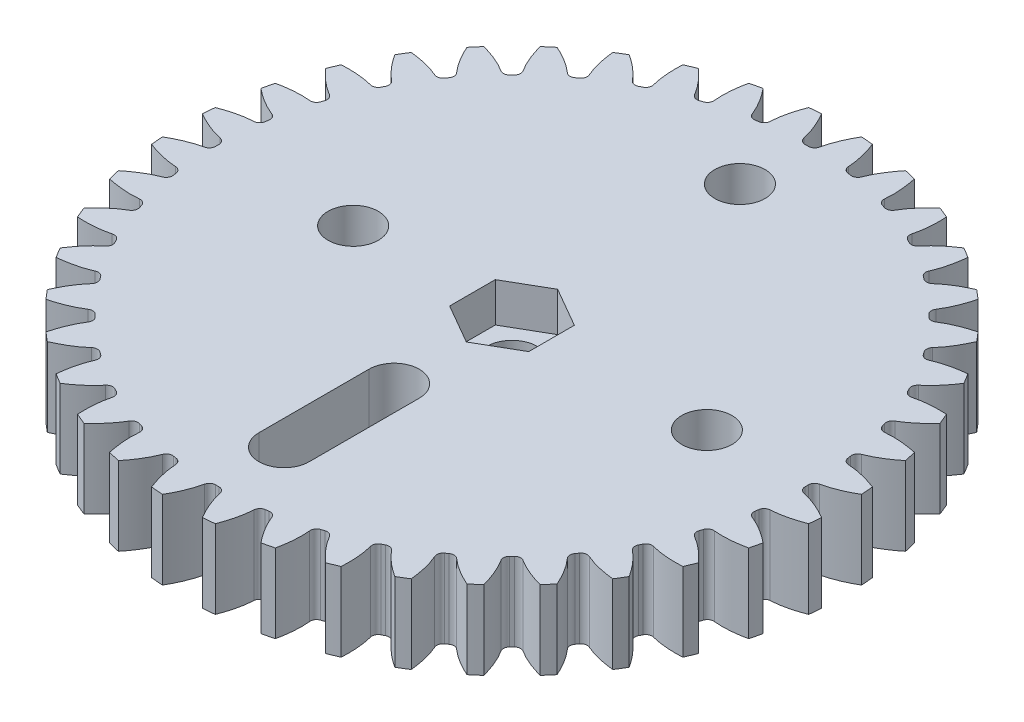
from build123d import *

# Parameters (mm, degrees)
SKETCH2_R                = 53.34
BOSS_EXTRUDE1_DEPTH      = 12.7
CUT_EXTRUDE1_DEPTH       = 12.7
FILLET2_R                = 1.016
CIRPATTERN1_COUNT        = 40
FILLET2_OF_CIRPATTERN1_R = 1.016
SKETCH4_R                = 4.09575
CUT_EXTRUDE2_DEPTH       = 77.359986682
CUT_EXTRUDE3_DEPTH       = 6.35
CUT_EXTRUDE4_DEPTH       = 77.359986682
CUT_EXTRUDE4_DEPTH_BACK  = 77.359986682
SKETCH6_R                = 4.064


with BuildPart() as part:
    # Sketch2 → Boss-Extrude1 (new body)
    with BuildSketch(Plane(origin=(0, 0, 0), x_dir=(1, 0, 0), z_dir=(0, 1, 0))):
        Circle(SKETCH2_R)
    extrude(amount=BOSS_EXTRUDE1_DEPTH)

    # Sketch3 → Cut-Extrude1 (cut)
    with BuildSketch(Plane(origin=(0, 0, 0), x_dir=(-1, 0, 0), z_dir=(0, -1, 0))):
        with BuildLine():
            Line((47.610863724, -1.16029328), (47.722215798, -1.163006969))
            add(Edge.make_bspline(
                [(47.722215798, -1.163006969), (47.730982789, -1.163313167), (47.755564012, -1.16445845), (47.802003051, -1.167754997), (47.87772523, -1.174741096), (47.974119041, -1.186004909), (48.098593622, -1.203276497), (48.245061479, -1.227112329), (48.405834144, -1.256963367), (48.580520514, -1.293386204), (48.754577285, -1.333212779), (48.927987969, -1.376189951), (49.100522746, -1.421931459), (49.30925176, -1.48080125), (49.559155717, -1.556203831), (49.850651678, -1.651349023), (50.180503564, -1.767531099), (50.515821541, -1.894787282), (50.845048793, -2.027276114), (51.176798745, -2.169495413), (51.497150175, -2.313020498), (51.828924093, -2.470658837), (52.134675109, -2.620519189), (52.476090794, -2.797888155), (52.751288045, -2.94379105), (53.034579939, -3.102405155), (53.172312998, -3.180768911), (53.242640535, -3.221308569)],
                knots=[0, 0, 0, 0, 0, 0.005376749, 0.015083688, 0.02853182, 0.04661014, 0.064854849, 0.092110526, 0.119476176, 0.146842496, 0.174208854, 0.201574956, 0.228941013, 0.256307345, 0.307035032, 0.361767352, 0.416499661, 0.471231937, 0.525964282, 0.580696616, 0.635428982, 0.690161387, 0.744893688, 0.799626082, 0.854358407, 0.909090914, 0.909090914, 0.909090914, 0.909090914, 0.909090914], degree=4))
            ThreePointArc((53.242640535, -3.221308569), (53.34, 0), (53.242640535, 3.221308569))
            add(Edge.make_bspline(
                [(53.242640535, 3.221308569), (53.172312998, 3.180768911), (53.034579939, 3.102405155), (52.751288045, 2.94379105), (52.476090794, 2.797888155), (52.134675109, 2.620519189), (51.828924093, 2.470658837), (51.497150175, 2.313020498), (51.176798745, 2.169495413), (50.845048793, 2.027276114), (50.515821541, 1.894787282), (50.180503564, 1.767531099), (49.850651678, 1.651349023), (49.559155717, 1.556203831), (49.30925176, 1.48080125), (49.100522746, 1.421931459), (48.927987969, 1.376189951), (48.754577285, 1.333212779), (48.580520514, 1.293386204), (48.405834144, 1.256963367), (48.245061479, 1.227112329), (48.098593622, 1.203276497), (47.974119041, 1.186004909), (47.87772523, 1.174741096), (47.80200305, 1.167754997), (47.755564012, 1.16445845), (47.730982789, 1.163313167), (47.722215798, 1.163006969)],
                knots=[0.484570751, 0.484570751, 0.484570751, 0.484570751, 0.484570751, 0.539303258, 0.594035583, 0.648767977, 0.703500278, 0.758232683, 0.81296505, 0.867697383, 0.922429728, 0.977162004, 1.031894313, 1.086626633, 1.13735432, 1.164720652, 1.19208671, 1.219452811, 1.246819169, 1.274185489, 1.30155114, 1.328806816, 1.347051526, 1.365129845, 1.378577977, 1.388284917, 1.393661665, 1.393661665, 1.393661665, 1.393661665, 1.393661665], degree=4))
            Line((47.722215798, 1.163006969), (47.610863724, 1.16029328))
            ThreePointArc((47.610863724, 1.16029328), (47.625, 0), (47.610863724, -1.16029328))
        make_face()
    cut_extrude1 = extrude(amount=-CUT_EXTRUDE1_DEPTH, mode=Mode.SUBTRACT)

    # Fillet2
    fillet2_edges = [part.edges().sort_by_distance(p)[0] for p in [
        (-47.610863724, 6.35, -1.16029328),
        (-47.610863724, 6.35, 1.16029328),
    ]]
    fillet(fillet2_edges, radius=FILLET2_R)

    # CirPattern1: Cut-Extrude1 ×40 about axis
    cirpattern1_axis = Axis((0, 12.7, 0), (0, 1, 0))
    for i in range(1, CIRPATTERN1_COUNT):
        add(cut_extrude1.rotate(cirpattern1_axis, i * 360 / CIRPATTERN1_COUNT), mode=Mode.SUBTRACT)

    # Fillet2 of CirPattern1
    fillet2_of_cirpattern1_edges = [part.edges().sort_by_distance(p)[0] for p in [
        (-47.206204844, 6.35, 6.301971852),
        (-46.843185127, 6.35, 8.593988141),
        (-45.639172533, 6.35, 13.609061523),
        (-44.922071849, 6.35, 15.816070492),
        (-42.948352326, 6.35, 20.581050932),
        (-41.894828074, 6.35, 22.648708697),
        (-39.200001148, 6.35, 27.046266564),
        (-37.835994591, 6.35, 28.923660528),
        (-34.486415844, 6.35, 32.845513351),
        (-32.845513351, 6.35, 34.486415844),
        (-28.923660528, 6.35, 37.835994591),
        (-27.046266564, 6.35, 39.200001148),
        (-22.648708697, 6.35, 41.894828074),
        (-20.581050932, 6.35, 42.948352326),
        (-15.816070492, 6.35, 44.922071849),
        (-13.609061523, 6.35, 45.639172533),
        (-8.593988141, 6.35, 46.843185127),
        (-6.301971852, 6.35, 47.206204844),
        (-1.16029328, 6.35, 47.610863724),
        (1.16029328, 6.35, 47.610863724),
        (6.301971852, 6.35, 47.206204844),
        (8.593988141, 6.35, 46.843185127),
        (13.609061523, 6.35, 45.639172533),
        (15.816070492, 6.35, 44.922071849),
        (20.581050932, 6.35, 42.948352326),
        (22.648708697, 6.35, 41.894828074),
        (27.046266564, 6.35, 39.200001148),
        (28.923660528, 6.35, 37.835994591),
        (32.845513351, 6.35, 34.486415844),
        (34.486415844, 6.35, 32.845513351),
        (37.835994591, 6.35, 28.923660528),
        (39.200001148, 6.35, 27.046266564),
        (41.894828074, 6.35, 22.648708697),
        (42.948352326, 6.35, 20.581050932),
        (44.922071849, 6.35, 15.816070492),
        (45.639172533, 6.35, 13.609061523),
        (46.843185127, 6.35, 8.593988141),
        (47.206204844, 6.35, 6.301971852),
        (47.610863724, 6.35, 1.16029328),
        (47.610863724, 6.35, -1.16029328),
        (47.206204844, 6.35, -6.301971852),
        (46.843185127, 6.35, -8.593988141),
        (45.639172533, 6.35, -13.609061523),
        (44.922071849, 6.35, -15.816070492),
        (42.948352326, 6.35, -20.581050932),
        (41.894828074, 6.35, -22.648708697),
        (39.200001148, 6.35, -27.046266564),
        (37.835994591, 6.35, -28.923660528),
        (34.486415844, 6.35, -32.845513351),
        (32.845513351, 6.35, -34.486415844),
        (28.923660528, 6.35, -37.835994591),
        (27.046266564, 6.35, -39.200001148),
        (22.648708697, 6.35, -41.894828074),
        (20.581050932, 6.35, -42.948352326),
        (15.816070492, 6.35, -44.922071849),
        (13.609061523, 6.35, -45.639172533),
        (8.593988141, 6.35, -46.843185127),
        (6.301971852, 6.35, -47.206204844),
        (1.16029328, 6.35, -47.610863724),
        (-1.16029328, 6.35, -47.610863724),
        (-6.301971852, 6.35, -47.206204844),
        (-8.593988141, 6.35, -46.843185127),
        (-13.609061523, 6.35, -45.639172533),
        (-15.816070492, 6.35, -44.922071849),
        (-20.581050932, 6.35, -42.948352326),
        (-22.648708697, 6.35, -41.894828074),
        (-27.046266564, 6.35, -39.200001148),
        (-28.923660528, 6.35, -37.835994591),
        (-32.845513351, 6.35, -34.486415844),
        (-34.486415844, 6.35, -32.845513351),
        (-37.835994591, 6.35, -28.923660528),
        (-39.200001148, 6.35, -27.046266564),
        (-41.894828074, 6.35, -22.648708697),
        (-42.948352326, 6.35, -20.581050932),
        (-44.922071849, 6.35, -15.816070492),
        (-45.639172533, 6.35, -13.609061523),
        (-46.843185127, 6.35, -8.593988141),
        (-47.206204844, 6.35, -6.301971852),
    ]]
    fillet(fillet2_of_cirpattern1_edges, radius=FILLET2_OF_CIRPATTERN1_R)

    # Sketch4 → Cut-Extrude2 (cut, through all)
    with BuildSketch(Plane(origin=(0, 12.7, 0), x_dir=(1, 0, 0), z_dir=(0, 1, 0))):
        Circle(SKETCH4_R)
    extrude(amount=-CUT_EXTRUDE2_DEPTH, mode=Mode.SUBTRACT)

    # Sketch5 → Cut-Extrude3 (cut)
    with BuildSketch(Plane(origin=(0, 12.7, 0), x_dir=(1, 0, 0), z_dir=(0, 1, 0))):
        Polygon((0, 7.376342509), (-6.3881, 3.688171255), (-6.3881, -3.688171255), (0, -7.376342509), (6.3881, -3.688171255), (6.3881, 3.688171255), align=None)
    extrude(amount=-CUT_EXTRUDE3_DEPTH, mode=Mode.SUBTRACT)

    # Sketch6 → Cut-Extrude4 (cut, two sides: drawn at the far end of the back side and taken through both)
    with BuildSketch(Plane(origin=(0, 12.7, 0), x_dir=(1, 0, 0), z_dir=(0, 1, 0)).offset(-CUT_EXTRUDE4_DEPTH_BACK)):
        with Locations((0, 36.83)):
            Circle(SKETCH6_R)
        with Locations((31.75, -0.262923867)):
            Circle(SKETCH6_R)
        with Locations((-25.4, -0.262923867)):
            Circle(SKETCH6_R)
        with BuildLine():
            Line((4.064, -19.05), (4.064, -36.83))
            ThreePointArc((4.064, -36.83), (0, -40.894), (-4.064, -36.83))
            Line((-4.064, -36.83), (-4.064, -19.05))
            ThreePointArc((-4.064, -19.05), (0, -14.986), (4.064, -19.05))
        make_face()
    extrude(amount=CUT_EXTRUDE4_DEPTH + CUT_EXTRUDE4_DEPTH_BACK, mode=Mode.SUBTRACT)


solid = part.part
